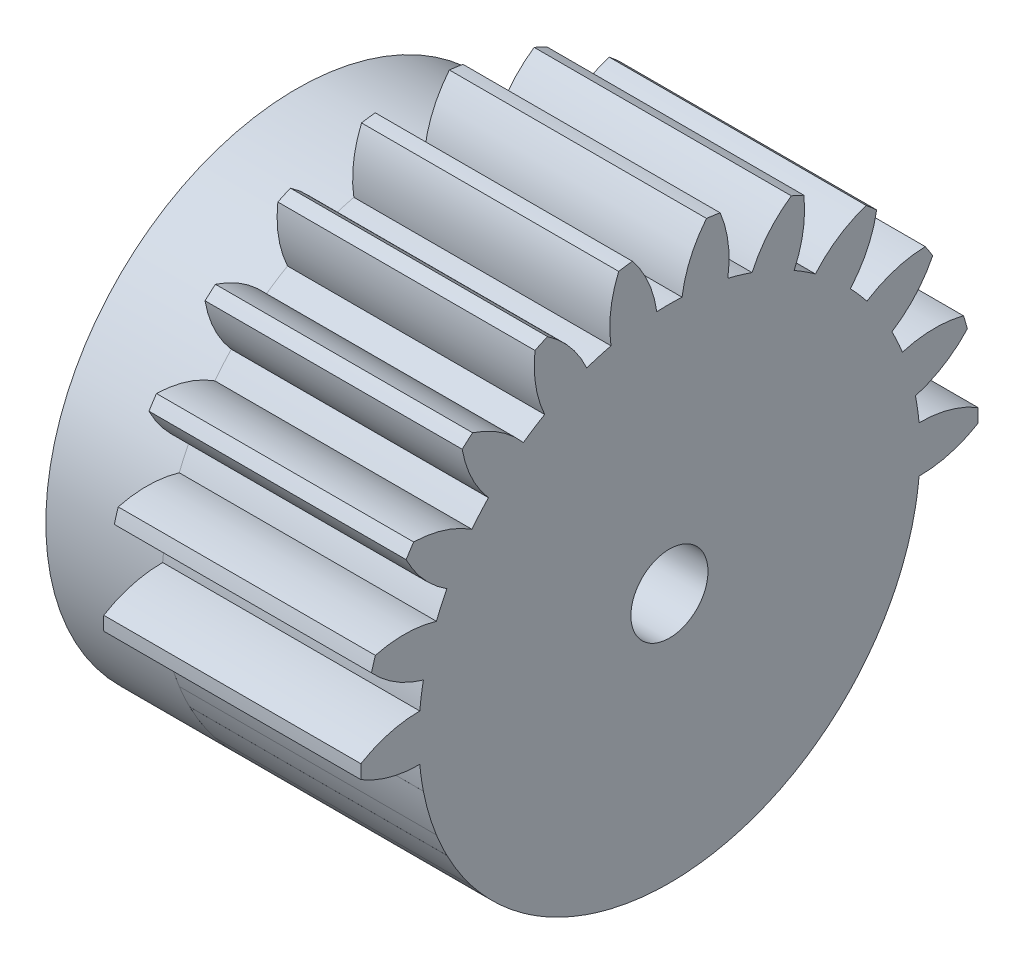
from build123d import *

# Parameters (mm, degrees)
SKETCH5_R           = 1.5
BOSS_EXTRUDE1_DEPTH = 10
SKETCH10_W          = 4.5
SKETCH10_H          = 6.3
CUT_EXTRUDE1_DEPTH  = 10


with BuildPart() as part:
    # Sketch5 → Boss-Extrude1 (new body)
    with BuildSketch(Plane(origin=(4.038890567, 0, 0), x_dir=(0, 0, -1), z_dir=(1, 0, 0))):
        with BuildLine():
            ThreePointArc((-8.767047038, 4.183890551), (-7.665653193, 3.710793481), (-6.477446097, 3.552511658))
            ThreePointArc((-6.477446097, 3.552511658), (-6.419815651, 3.06474668), (-6.337692385, 2.580503238))
            ThreePointArc((-6.337692385, 2.580503238), (-7.433175602, 2.093876318), (-8.35666841, 1.329644499))
            ThreePointArc((-8.35666841, 1.329644499), (-8.283962098, 1.071383356), (-8.205500024, 0.814812257))
            ThreePointArc((-8.205500024, 0.814812257), (-7.015433522, 0.671177447), (-5.830764019, 0.854063773))
            ThreePointArc((-5.830764019, 0.854063773), (-5.638048737, 0.402293077), (-5.422824897, -0.039198306))
            ThreePointArc((-5.422824897, -0.039198306), (-6.3368347, -0.814746704), (-7.007610576, -1.808199754))
            ThreePointArc((-7.007610576, -1.808199754), (-6.865088808, -2.035515771), (-6.717520569, -2.259588617))
            ThreePointArc((-6.717520569, -2.259588617), (-5.535193519, -2.06212473), (-4.450036487, -1.552886617))
            ThreePointArc((-4.450036487, -1.552886617), (-4.137849015, -1.932063257), (-3.806960756, -2.295035573))
            ThreePointArc((-3.806960756, -2.295035573), (-4.465449507, -3.296675131), (-4.829166179, -4.438865755))
            ThreePointArc((-4.829166179, -4.438865755), (-4.628375221, -4.616820854), (-4.423655917, -4.790242398))
            ThreePointArc((-4.423655917, -4.790242398), (-3.344853426, -4.267677163), (-2.447121834, -3.473342707))
            ThreePointArc((-2.447121834, -3.473342707), (-2.040753744, -3.749206653), (-1.621007666, -4.004254045))
            ThreePointArc((-1.621007666, -4.004254045), (-1.970628521, -5.150837883), (-1.997819828, -6.349232589))
            ThreePointArc((-1.997819828, -6.349232589), (-1.75502657, -6.463409906), (-1.50974134, -6.572130566))
            ThreePointArc((-1.50974134, -6.572130566), (-0.62186157, -5.76679911), (0.015715707, -4.751720564))
            ThreePointArc((0.015715707, -4.751720564), (0.483342889, -4.901922961), (0.957941455, -5.028383006))
            ThreePointArc((0.957941455, -5.028383006), (0.945512697, -6.22702172), (1.257049634, -7.384533696))
            ThreePointArc((1.257049634, -7.384533696), (1.522175527, -7.425683264), (1.788155131, -7.460895139))
            ThreePointArc((1.788155131, -7.460895139), (2.413181441, -6.438040628), (2.738951684, -5.284453619))
            ThreePointArc((2.738951684, -5.284453619), (3.229953586, -5.296825962), (3.720955487, -5.284453619))
            ThreePointArc((3.720955487, -5.284453619), (4.04672573, -6.438040628), (4.671752041, -7.460895139))
            ThreePointArc((4.671752041, -7.460895139), (4.937731645, -7.425683264), (5.202857538, -7.384533696))
            ThreePointArc((5.202857538, -7.384533696), (5.514394474, -6.22702172), (5.501965716, -5.028383006))
            ThreePointArc((5.501965716, -5.028383006), (5.976564282, -4.901922961), (6.444191465, -4.751720564))
            ThreePointArc((6.444191465, -4.751720564), (7.081768742, -5.76679911), (7.969648512, -6.572130566))
            ThreePointArc((7.969648512, -6.572130566), (8.214933742, -6.463409906), (8.457727, -6.349232589))
            ThreePointArc((8.457727, -6.349232589), (8.430535693, -5.150837883), (8.080914837, -4.004254045))
            ThreePointArc((8.080914837, -4.004254045), (8.500660915, -3.749206653), (8.907029006, -3.473342707))
            ThreePointArc((8.907029006, -3.473342707), (9.804760597, -4.267677163), (10.883563088, -4.790242398))
            ThreePointArc((10.883563088, -4.790242398), (11.088282393, -4.616820854), (11.289073351, -4.438865755))
            ThreePointArc((11.289073351, -4.438865755), (10.925356678, -3.296675131), (10.266867928, -2.295035573))
            ThreePointArc((10.266867928, -2.295035573), (10.597756186, -1.932063257), (10.909943659, -1.552886617))
            ThreePointArc((10.909943659, -1.552886617), (11.995100691, -2.06212473), (13.17742774, -2.259588617))
            ThreePointArc((13.17742774, -2.259588617), (13.32499598, -2.035515771), (13.467517748, -1.808199754))
            ThreePointArc((13.467517748, -1.808199754), (12.796741871, -0.814746704), (11.882732068, -0.039198306))
            ThreePointArc((11.882732068, -0.039198306), (12.097955909, 0.402293077), (12.290671191, 0.854063773))
            ThreePointArc((12.290671191, 0.854063773), (13.475340694, 0.671177447), (14.665407196, 0.814812257))
            ThreePointArc((14.665407196, 0.814812257), (14.743869269, 1.071383356), (14.816575582, 1.329644499))
            ThreePointArc((14.816575582, 1.329644499), (13.893082774, 2.093876318), (12.797599556, 2.580503238))
            ThreePointArc((12.797599556, 2.580503238), (12.879722823, 3.06474668), (12.937353269, 3.552511658))
            ThreePointArc((12.937353269, 3.552511658), (14.125560365, 3.710793481), (15.22695421, 4.183890551))
            ThreePointArc((15.22695421, 4.183890551), (15.229953586, 4.452174038), (15.22695421, 4.720457526))
            ThreePointArc((15.22695421, 4.720457526), (14.125560365, 5.193554596), (12.937353269, 5.351836419))
            ThreePointArc((12.937353269, 5.351836419), (12.879722823, 5.839601397), (12.797599556, 6.323844839))
            ThreePointArc((12.797599556, 6.323844839), (13.893082774, 6.810471759), (14.816575582, 7.574703578))
            ThreePointArc((14.816575582, 7.574703578), (14.743869269, 7.832964721), (14.665407196, 8.08953582))
            ThreePointArc((14.665407196, 8.08953582), (13.475340694, 8.23317063), (12.290671191, 8.050284304))
            ThreePointArc((12.290671191, 8.050284304), (12.097955909, 8.502055), (11.882732068, 8.943546382))
            ThreePointArc((11.882732068, 8.943546382), (12.796741871, 9.719094781), (13.467517748, 10.712547831))
            ThreePointArc((13.467517748, 10.712547831), (13.32499598, 10.939863848), (13.17742774, 11.163936694))
            ThreePointArc((13.17742774, 11.163936694), (11.995100691, 10.966472807), (10.909943659, 10.457234694))
            ThreePointArc((10.909943659, 10.457234694), (10.597756186, 10.836411334), (10.266867928, 11.19938365))
            ThreePointArc((10.266867928, 11.19938365), (10.925356678, 12.201023208), (11.289073351, 13.343213832))
            ThreePointArc((11.289073351, 13.343213832), (11.088282393, 13.521168931), (10.883563088, 13.694590475))
            ThreePointArc((10.883563088, 13.694590475), (9.804760597, 13.17202524), (8.907029006, 12.377690783))
            ThreePointArc((8.907029006, 12.377690783), (8.500660915, 12.65355473), (8.080914837, 12.908602122))
            ThreePointArc((8.080914837, 12.908602122), (8.430535693, 14.05518596), (8.457727, 15.253580666))
            ThreePointArc((8.457727, 15.253580666), (8.214933742, 15.367757983), (7.969648512, 15.476478643))
            ThreePointArc((7.969648512, 15.476478643), (7.081768742, 14.671147187), (6.444191465, 13.656068641))
            ThreePointArc((6.444191465, 13.656068641), (5.976564282, 13.806271038), (5.501965716, 13.932731083))
            ThreePointArc((5.501965716, 13.932731083), (5.514394474, 15.131369796), (5.202857538, 16.288881773))
            ThreePointArc((5.202857538, 16.288881773), (4.937731645, 16.330031341), (4.671752041, 16.365243215))
            ThreePointArc((4.671752041, 16.365243215), (4.04672573, 15.342388705), (3.720955487, 14.188801696))
            ThreePointArc((3.720955487, 14.188801696), (3.229953586, 14.201174038), (2.738951684, 14.188801696))
            ThreePointArc((2.738951684, 14.188801696), (2.413181441, 15.342388705), (1.788155131, 16.365243215))
            ThreePointArc((1.788155131, 16.365243215), (1.522175527, 16.330031341), (1.257049634, 16.288881773))
            ThreePointArc((1.257049634, 16.288881773), (0.945512697, 15.131369796), (0.957941455, 13.932731083))
            ThreePointArc((0.957941455, 13.932731083), (0.483342889, 13.806271038), (0.015715707, 13.656068641))
            ThreePointArc((0.015715707, 13.656068641), (-0.62186157, 14.671147187), (-1.50974134, 15.476478643))
            ThreePointArc((-1.50974134, 15.476478643), (-1.75502657, 15.367757983), (-1.997819828, 15.253580666))
            ThreePointArc((-1.997819828, 15.253580666), (-1.970628521, 14.05518596), (-1.621007666, 12.908602122))
            ThreePointArc((-1.621007666, 12.908602122), (-2.040753744, 12.65355473), (-2.447121834, 12.377690783))
            ThreePointArc((-2.447121834, 12.377690783), (-3.344853426, 13.17202524), (-4.423655917, 13.694590475))
            ThreePointArc((-4.423655917, 13.694590475), (-4.628375221, 13.521168931), (-4.829166179, 13.343213832))
            ThreePointArc((-4.829166179, 13.343213832), (-4.465449507, 12.201023208), (-3.806960756, 11.19938365))
            ThreePointArc((-3.806960756, 11.19938365), (-4.137849015, 10.836411334), (-4.450036487, 10.457234694))
            ThreePointArc((-4.450036487, 10.457234694), (-5.535193519, 10.966472807), (-6.717520569, 11.163936694))
            ThreePointArc((-6.717520569, 11.163936694), (-6.865088808, 10.939863848), (-7.007610576, 10.712547831))
            ThreePointArc((-7.007610576, 10.712547831), (-6.3368347, 9.719094781), (-5.422824897, 8.943546382))
            ThreePointArc((-5.422824897, 8.943546382), (-5.638048737, 8.502055), (-5.830764019, 8.050284304))
            ThreePointArc((-5.830764019, 8.050284304), (-7.015433522, 8.23317063), (-8.205500024, 8.08953582))
            ThreePointArc((-8.205500024, 8.08953582), (-8.283962098, 7.832964721), (-8.35666841, 7.574703578))
            ThreePointArc((-8.35666841, 7.574703578), (-7.433175602, 6.810471759), (-6.337692385, 6.323844839))
            ThreePointArc((-6.337692385, 6.323844839), (-6.419815651, 5.839601397), (-6.477446097, 5.351836419))
            ThreePointArc((-6.477446097, 5.351836419), (-7.665653193, 5.193554596), (-8.767047038, 4.720457526))
            ThreePointArc((-8.767047038, 4.720457526), (-8.770046414, 4.452174038), (-8.767047038, 4.183890551))
        make_face()
        with Locations((3.229953586, 4.452174038)):
            Circle(SKETCH5_R, mode=Mode.SUBTRACT)
    extrude(amount=-BOSS_EXTRUDE1_DEPTH)

    # Sketch11 → Cut-Extrude1 (cut)
    with BuildSketch(Plane(origin=(4.038890567, 0, 0), x_dir=(0, 0, -1), z_dir=(1, 0, 0))):
        with BuildLine():
            Line((-9.20266534, 3.156031046), (-6.433509217, 3.156031046))
            ThreePointArc((-6.433509217, 3.156031046), (3.229953586, -5.297825962), (12.893416389, 3.156031046))
            Line((12.893416389, 3.156031046), (15.662572511, 3.156031046))
            ThreePointArc((15.662572511, 3.156031046), (3.229953586, -8.047825962), (-9.20266534, 3.156031046))
        make_face()
    extrude(amount=-CUT_EXTRUDE1_DEPTH, mode=Mode.SUBTRACT)


with BuildPart() as body_2:
    # Sketch10 → Revolve2 (revolve)
    with BuildSketch(Plane.XY.offset(-3.229953586)):
        with Locations((-8.211109433, 11.052174038)):
            Rectangle(SKETCH10_W, SKETCH10_H)
    revolve(axis=Axis((-10.461109433, 4.452174038, -3.229953586), (1, 0, 0)))


solid = Compound([part.part, body_2.part])
